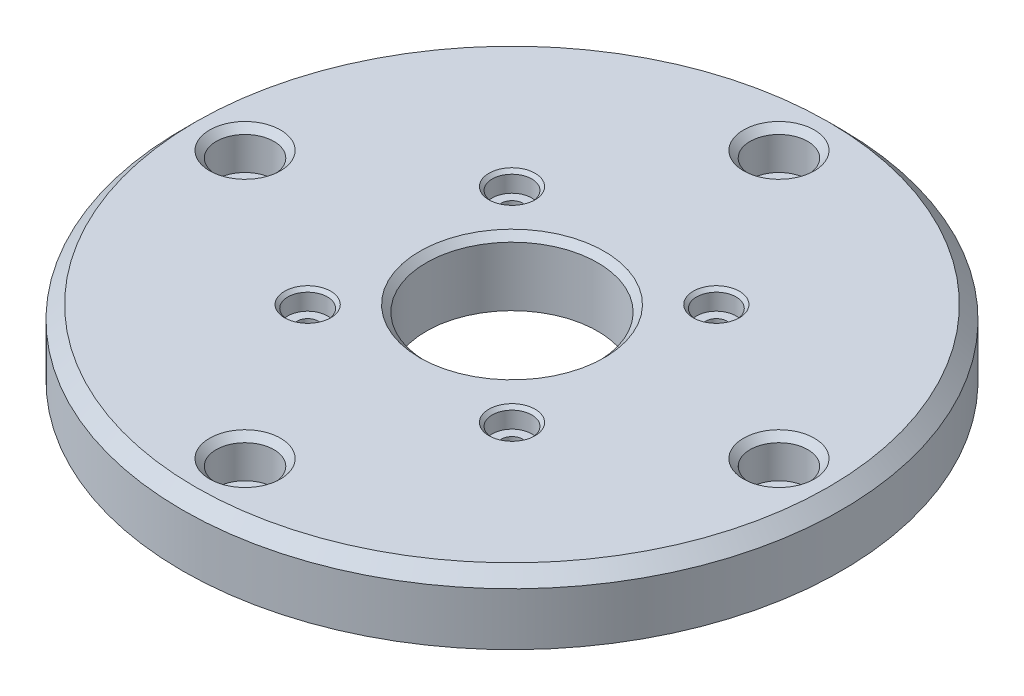
from build123d import *

# Parameters (mm, degrees)
SKETCH1_R           = 50
SKETCH1_R_2         = 13
SKETCH1_R_3         = 1.625
SKETCH1_R_4         = 2.65
BOSS_EXTRUDE1_DEPTH = 10
SKETCH2_R           = 3
CUT_EXTRUDE1_DEPTH  = 3
SKETCH3_R           = 4.375
CUT_EXTRUDE2_DEPTH  = 6
CHAMFER3_SIZE       = 1
CHAMFER4_SIZE       = 0.5


with BuildPart() as part:
    # Sketch1 → Boss-Extrude1 (new body)
    with BuildSketch(Plane(origin=(0, 0, 0), x_dir=(1, 0, 0), z_dir=(0, 1, 0))):
        with Locations(Location((0, 0, 0), (0, 0, 270))):
            Circle(SKETCH1_R)
        with Locations(Location((0, 0, 0), (0, 0, 270))):
            Circle(SKETCH1_R_2, mode=Mode.SUBTRACT)
        with Locations(Location((15.5, 15.5, 0), (0, 0, 270))):
            Circle(SKETCH1_R_3, mode=Mode.SUBTRACT)
        with Locations(Location((15.5, -15.5, 0), (0, 0, 270))):
            Circle(SKETCH1_R_3, mode=Mode.SUBTRACT)
        with Locations(Location((-15.5, -15.5, 0), (0, 0, 270))):
            Circle(SKETCH1_R_3, mode=Mode.SUBTRACT)
        with Locations(Location((-15.5, 15.5, 0), (0, 0, 270))):
            Circle(SKETCH1_R_3, mode=Mode.SUBTRACT)
        with Locations(Location((40.5, 0, 0), (0, 0, 270))):
            Circle(SKETCH1_R_4, mode=Mode.SUBTRACT)
        with Locations(Location((0, -40.5, 0), (0, 0, 270))):
            Circle(SKETCH1_R_4, mode=Mode.SUBTRACT)
        with Locations(Location((-40.5, 0, 0), (0, 0, 270))):
            Circle(SKETCH1_R_4, mode=Mode.SUBTRACT)
        with Locations(Location((0, 40.5, 0), (0, 0, 270))):
            Circle(SKETCH1_R_4, mode=Mode.SUBTRACT)
    extrude(amount=BOSS_EXTRUDE1_DEPTH)

    # Chamfer1: read off the stored shape, not the designer's step
    # Chamfer1 outline → Chamfer1 (revolve, cut)
    with BuildSketch(Plane.XY):
        Polygon((50, 10), (48, 10), (50, 8), align=None)
    revolve(axis=Axis((0, 0, 0), (0, 1, 0)), mode=Mode.SUBTRACT)

    # Sketch2 → Cut-Extrude1 (cut)
    with BuildSketch(Plane(origin=(0, 10, 0), x_dir=(1, 0, 0), z_dir=(0, 1, 0))):
        with Locations(Location((-15.5, 15.5, 0), (0, 0, 270))):
            Circle(SKETCH2_R)
        with Locations(Location((15.5, 15.5, 0), (0, 0, 270))):
            Circle(SKETCH2_R)
        with Locations(Location((15.5, -15.5, 0), (0, 0, 270))):
            Circle(SKETCH2_R)
        with Locations(Location((-15.5, -15.5, 0), (0, 0, 270))):
            Circle(SKETCH2_R)
    extrude(amount=-CUT_EXTRUDE1_DEPTH, mode=Mode.SUBTRACT)

    # Chamfer2: read off the stored shape, not the designer's step
    # Chamfer2 outline → Chamfer2 (revolve, cut)
    with BuildSketch(Plane.XY):
        Polygon((13, 10), (13, 9), (14, 10), align=None)
    revolve(axis=Axis((0, 0, 0), (0, 1, 0)), mode=Mode.SUBTRACT)

    # Sketch3 → Cut-Extrude2 (cut)
    with BuildSketch(Plane(origin=(0, 10, 0), x_dir=(1, 0, 0), z_dir=(0, 1, 0))):
        with Locations(Location((40.5, 0, 0), (0, 0, 270))):
            Circle(SKETCH3_R)
        with Locations(Location((0, -40.5, 0), (0, 0, 270))):
            Circle(SKETCH3_R)
        with Locations(Location((-40.5, 0, 0), (0, 0, 270))):
            Circle(SKETCH3_R)
        with Locations(Location((0, 40.5, 0), (0, 0, 270))):
            Circle(SKETCH3_R)
    extrude(amount=-CUT_EXTRUDE2_DEPTH, mode=Mode.SUBTRACT)

    # Chamfer3
    chamfer3_edges = [part.edges().sort_by_distance(p)[0] for p in [
        (40.5, 10, -4.375),
        (0, 10, 36.125),
        (-40.5, 10, -4.375),
        (0, 10, -44.875),
    ]]
    chamfer(chamfer3_edges, length=CHAMFER3_SIZE)

    # Chamfer4
    chamfer4_edges = [part.edges().sort_by_distance(p)[0] for p in [
        (-15.5, 10, 12.5),
        (15.5, 10, 12.5),
        (15.5, 10, -18.5),
        (-15.5, 10, -18.5),
    ]]
    chamfer(chamfer4_edges, length=CHAMFER4_SIZE)


solid = part.part
